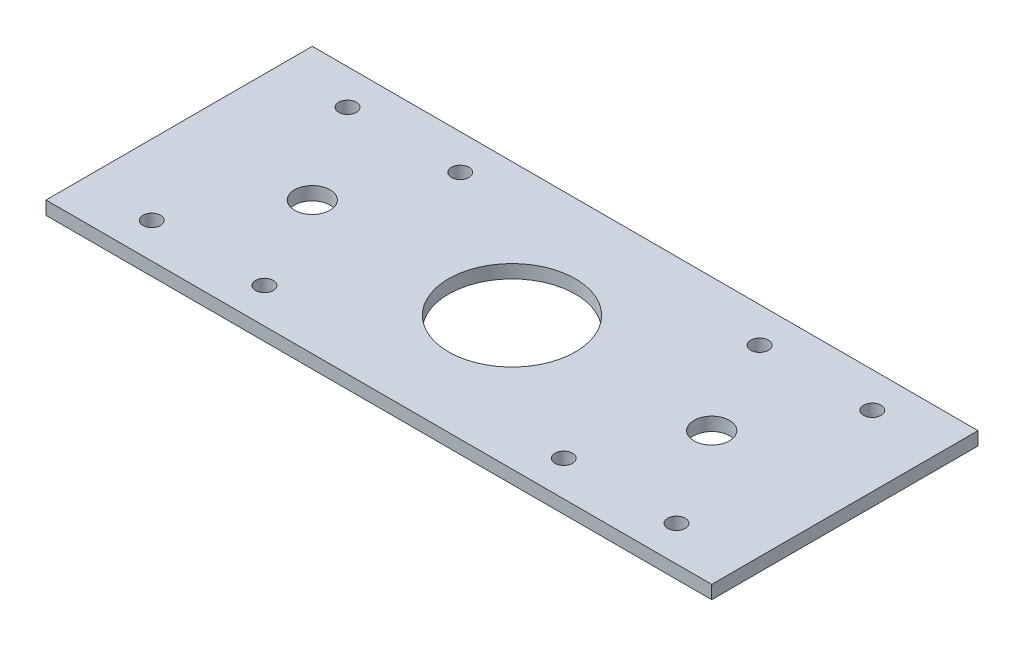
from build123d import *

# Parameters (mm, degrees)
SKETCH1_W           = 150
SKETCH1_H           = 60
BOSS_EXTRUDE1_DEPTH = 3
SKETCH2_R           = 14.2875
SKETCH2_R_2         = 1.984375
SKETCH2_R_3         = 4
CUT_EXTRUDE2_DEPTH  = 81.833161512


with BuildPart() as part:
    # Sketch1 → Boss-Extrude1 (new body)
    with BuildSketch(Plane(origin=(0, 0, 0), x_dir=(1, 0, 0), z_dir=(0, 1, 0))):
        Rectangle(SKETCH1_W, SKETCH1_H)
        Rectangle(SKETCH1_W, SKETCH1_H)
    extrude(amount=BOSS_EXTRUDE1_DEPTH)

    # Sketch2 → Cut-Extrude2 (cut, through all)
    with BuildSketch(Plane(origin=(0, 3, 0), x_dir=(1, 0, 0), z_dir=(0, 1, 0))):
        Circle(SKETCH2_R)
        with Locations((59.125, 22.0625)):
            Circle(SKETCH2_R_2)
        with Locations((33.725, 22.0625)):
            Circle(SKETCH2_R_2)
        with Locations((33.725, -22.0625)):
            Circle(SKETCH2_R_2)
        with Locations((59.125, -22.0625)):
            Circle(SKETCH2_R_2)
        with Locations((-33.725, 22.0625)):
            Circle(SKETCH2_R_2)
        with Locations((-59.125, 22.0625)):
            Circle(SKETCH2_R_2)
        with Locations((-59.125, -22.0625)):
            Circle(SKETCH2_R_2)
        with Locations((-33.725, -22.0625)):
            Circle(SKETCH2_R_2)
        with Locations((45, 0)):
            Circle(SKETCH2_R_3)
        with Locations((-45, 0)):
            Circle(SKETCH2_R_3)
    extrude(amount=-CUT_EXTRUDE2_DEPTH, mode=Mode.SUBTRACT)


solid = part.part
